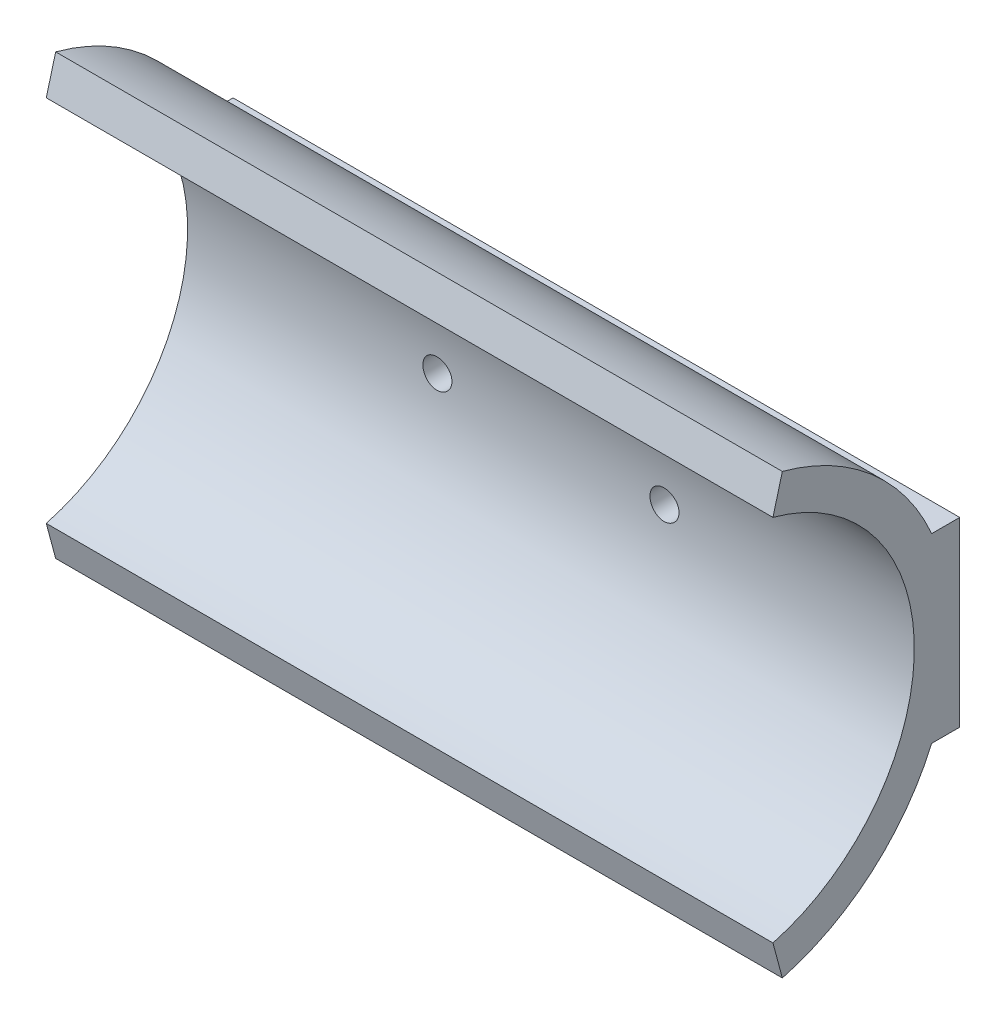
from build123d import *

# Parameters (mm, degrees)
BOSS_EXTRUDE1_DEPTH     = 40
CUT_EXTRUDE1_DEPTH      = 52.04942644
CUT_EXTRUDE1_DEPTH_BACK = 52.04942644
SKETCH2_R               = 1.6


with BuildPart() as part:
    # Sketch1 → Boss-Extrude1 (new, symmetric)
    with BuildSketch(Plane.YZ):
        with BuildLine():
            Line((20.284442352, -5.435199947), (24.148145657, -6.470476128))
            ThreePointArc((24.148145657, -6.470476128), (18.950253605, -16.306069064), (10, -22.912878475))
            Line((10, -22.912878475), (10, -26))
            Line((10, -26), (-10, -26))
            Line((-10, -26), (-10, -22.912878475))
            ThreePointArc((-10, -22.912878475), (-18.950253605, -16.306069064), (-24.148145657, -6.470476128))
            Line((-24.148145657, -6.470476128), (-20.284442352, -5.435199947))
            ThreePointArc((-20.284442352, -5.435199947), (0, -21), (20.284442352, -5.435199947))
        make_face()
    extrude(amount=BOSS_EXTRUDE1_DEPTH, both=True)

    # Sketch2 → Cut-Extrude1 (cut, two sides: drawn at the far end of the back side and taken through both)
    with BuildSketch(Plane(origin=(0, 0, -26), x_dir=(-1, 0, 0), z_dir=(0, 0, -1)).offset(-CUT_EXTRUDE1_DEPTH_BACK)):
        with Locations((12.5, 0)):
            Circle(SKETCH2_R)
        with Locations((-12.5, 0)):
            Circle(SKETCH2_R)
    extrude(amount=CUT_EXTRUDE1_DEPTH + CUT_EXTRUDE1_DEPTH_BACK, mode=Mode.SUBTRACT)


solid = part.part
